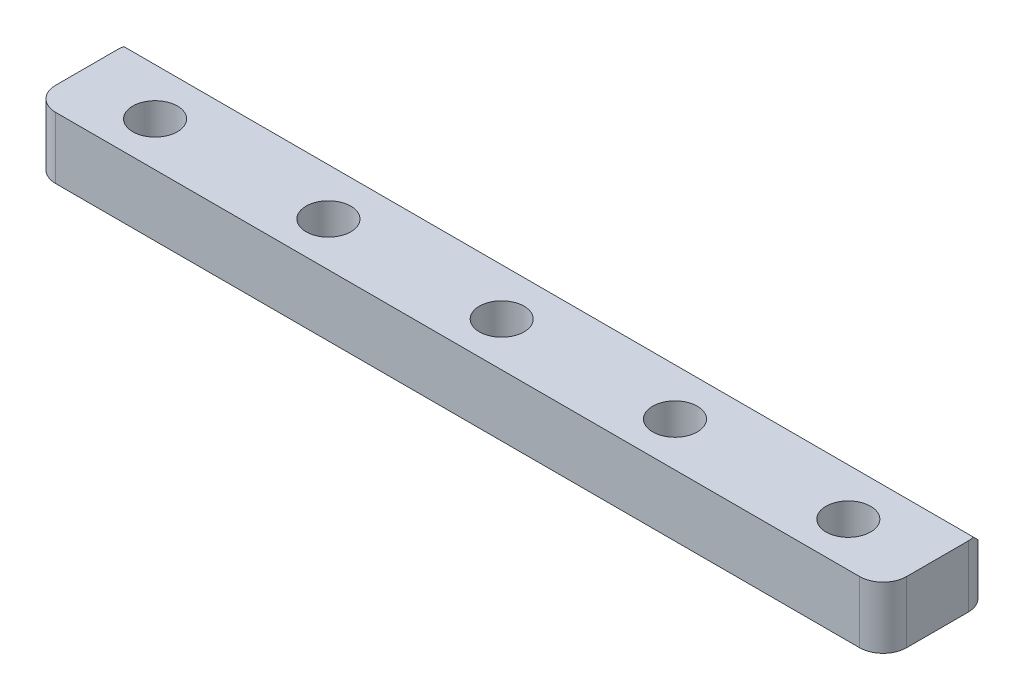
from build123d import *

# Parameters (mm, degrees)
CROQUIS1_R              = 1.9
SALIENTE_EXTRUIR1_DEPTH = 5.25
CHAFL_N1_SIZE           = 1.5


with BuildPart() as part:
    # Croquis1 → Saliente-Extruir1 (new body)
    with BuildSketch(Plane(origin=(0, 0, 0), x_dir=(1, 0, 0), z_dir=(0, 1, 0))):
        with BuildLine():
            Line((34.209401077, 5.5), (-34.209401077, 5.5))
            ThreePointArc((-34.209401077, 5.5), (-35.623614639, 4.914213562), (-36.209401077, 3.5))
            Line((-36.209401077, 3.5), (-36.209401077, -1.75))
            ThreePointArc((-36.209401077, -1.75), (-35.623614639, -3.164213562), (-34.209401077, -3.75))
            Line((-34.209401077, -3.75), (34.209401077, -3.75))
            ThreePointArc((34.209401077, -3.75), (35.623614639, -3.164213562), (36.209401077, -1.75))
            Line((36.209401077, -1.75), (36.209401077, 3.5))
            ThreePointArc((36.209401077, 3.5), (35.623614639, 4.914213562), (34.209401077, 5.5))
        make_face()
        with Locations(Location((29.498076211, 0, 0), (0, 0, 90))):
            Circle(CROQUIS1_R, mode=Mode.SUBTRACT)
        with Locations(Location((14.748076211, 0, 0), (0, 0, 90))):
            Circle(CROQUIS1_R, mode=Mode.SUBTRACT)
        with Locations(Location((0, 0, 0), (0, 0, 90))):
            Circle(CROQUIS1_R, mode=Mode.SUBTRACT)
        with Locations(Location((-14.748076211, 0, 0), (0, 0, 90))):
            Circle(CROQUIS1_R, mode=Mode.SUBTRACT)
        with Locations(Location((-29.498076211, 0, 0), (0, 0, 90))):
            Circle(CROQUIS1_R, mode=Mode.SUBTRACT)
    extrude(amount=SALIENTE_EXTRUIR1_DEPTH)

    # Chaflán1
    # the kernel refuses this chamfer: 1.5 mm, written as the material it takes off along each edge
    with BuildSketch(Plane(origin=(38.066925559, 5.25, -5.5), x_dir=(0, -0.9996219169112969, -0.027495876610586202), z_dir=(-1, 0, 0))) as chafl_n1_piece_1:
        Polygon((CHAFL_N1_SIZE * 0.999621916911, CHAFL_N1_SIZE * 0.0274958766106), (-CHAFL_N1_SIZE * 0.0274958766106, CHAFL_N1_SIZE * 0.999621916911), (0, 0), align=None)
    extrude(amount=76.133851117, mode=Mode.SUBTRACT)


solid = part.part
